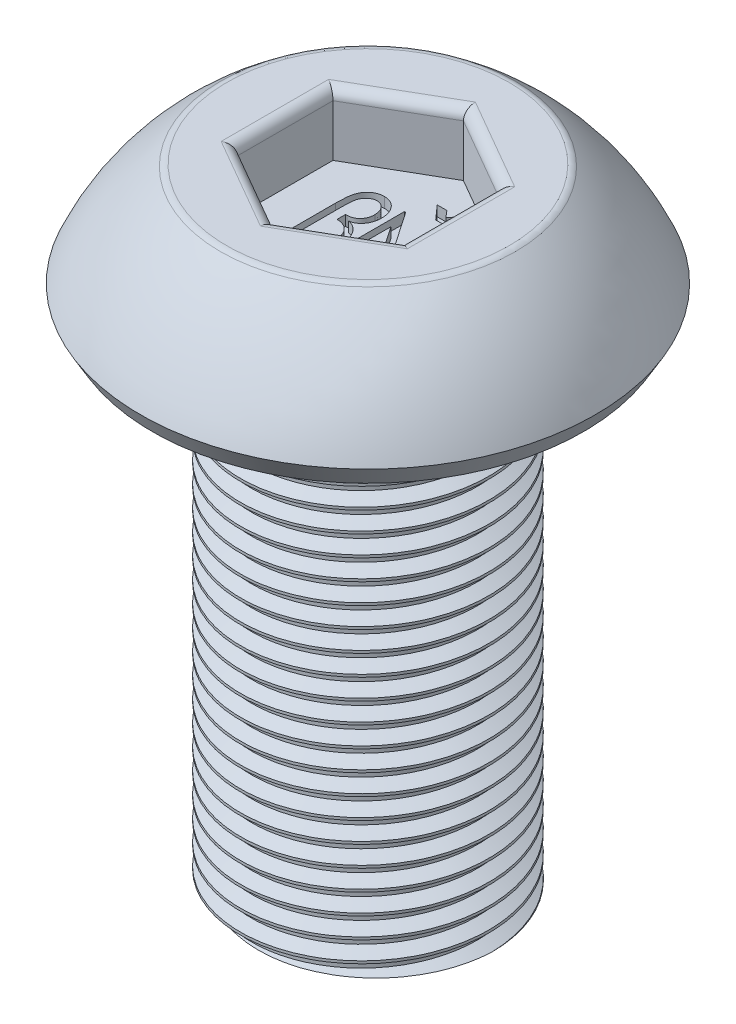
from build123d import *

# Parameters (mm, degrees)
CUT_EXTRUDE1_DEPTH = 0.75
FILLET1_R          = 0.125
WRAP1_START        = -0.125
WRAP1_DEPTH        = 0.125
THREAD1_PITCH      = 0.25


# Read off the part's stored shape, not the designer's step: Wrap1
with BuildPart() as part:
    # Sketch1 → Revolve1 (revolve)
    with BuildSketch(Plane(origin=(0, 0, 0), x_dir=(0, 0, -1), z_dir=(1, 0, 0)), mode=Mode.PRIVATE) as revolve1_sk:
        with BuildLine():
            Line((0, 1.5), (-1.75, 1.5))
            ThreePointArc((-1.75, 1.5), (-2.334912942, 0.942930354), (-2.75, 0.25))
            Line((-2.75, 0.25), (-2.605662433, 0))
            Line((-2.605662433, 0), (-1.5, 0))
            Line((-1.5, 0), (-1.5, -6))
            Line((-1.5, -6), (0, -6))
            Line((0, -6), (0, 1.5))
        make_face()
    revolve(revolve1_sk.sketch.rotate(Axis((0, -6, 0), (0, 1, 0)), 180), axis=Axis((0, -6, 0), (0, 1, 0)))

    # Sketch2 → Cut-Extrude1 (cut)
    with BuildSketch(Plane(origin=(0, 1.5, 0), x_dir=(1, 0, 0), z_dir=(0, 1, 0))):
        Polygon((0, 1.154700538), (-1, 0.577350269), (-1, -0.577350269), (0, -1.154700538), (1, -0.577350269), (1, 0.577350269), align=None)
    extrude(amount=-CUT_EXTRUDE1_DEPTH, mode=Mode.SUBTRACT)

    # Fillet1
    fillet1_edges = [part.edges().sort_by_distance(p)[0] for p in [
        (0.5, 1.5, -0.866025404),
        (-0.5, 1.5, -0.866025404),
        (-1, 1.5, 0),
        (-0.5, 1.5, 0.866025404),
        (0.5, 1.5, 0.866025404),
        (1, 1.5, 0),
        (0, 1.5, 1.75),
    ]]
    fillet(fillet1_edges, radius=FILLET1_R)

    # Wrap1 outline → Wrap1 (cut)
    with BuildSketch(Plane(origin=(0, 0.75, 0), x_dir=(1, 0, 0), z_dir=(0, 1, 0)).offset(WRAP1_START)):
        with BuildLine():
            add(Edge.make_bspline(
                [(-0.537455829, 0.145072229), (-0.537366548, 0.15735919), (-0.537194747, 0.181002472), (-0.536236546, 0.215136123), (-0.534510696, 0.246473554), (-0.531857696, 0.275057496), (-0.528751002, 0.300937263), (-0.524861231, 0.324098842), (-0.520025531, 0.344486675), (-0.512963856, 0.367808475), (-0.501673714, 0.39403328), (-0.484042302, 0.422215735), (-0.462961845, 0.447719467), (-0.43819726, 0.469796385), (-0.410438674, 0.48826361), (-0.379753396, 0.501330341), (-0.346770262, 0.509472114), (-0.323962243, 0.510388658), (-0.312295573, 0.510857485)],
                knots=[0, 0, 0, 0, 0.075666503, 0.145601872, 0.210267314, 0.268902852, 0.322354979, 0.370758742, 0.413447068, 0.451298193, 0.520734923, 0.588514213, 0.655379256, 0.723813985, 0.792131248, 0.85973193, 0.928250616, 1, 1, 1, 1], degree=3))
            Line((-0.537455829, 0.145072229), (-0.537455829, -0.527604053))
            Line((-0.537455829, -0.527604053), (-0.460532752, -0.527604053))
            Line((-0.460532752, -0.527604053), (-0.460532752, 0.137460049))
            add(Edge.make_bspline(
                [(-0.447712239, 0.305328639), (-0.448774545, 0.301469619), (-0.451134212, 0.292897693), (-0.453525545, 0.278533298), (-0.455753975, 0.261566558), (-0.457491806, 0.241915402), (-0.458861613, 0.219538201), (-0.459832928, 0.194491685), (-0.460431178, 0.166843342), (-0.460497896, 0.147543183), (-0.460532752, 0.137460049)],
                knots=[0, 0, 0, 0, 0.071102967, 0.157938928, 0.258486703, 0.375288845, 0.508476997, 0.656953648, 0.820779591, 1, 1, 1, 1], degree=3))
            add(Edge.make_bspline(
                [(-0.310292367, 0.421113895), (-0.317674297, 0.420714803), (-0.332400851, 0.419918636), (-0.353965955, 0.413875353), (-0.374511474, 0.403804365), (-0.393760239, 0.390026559), (-0.411220155, 0.372905819), (-0.426330799, 0.352966004), (-0.438683838, 0.330213781), (-0.444651659, 0.313764569), (-0.447712239, 0.305328639)],
                knots=[0, 0, 0, 0, 0.115143072, 0.229704239, 0.346728965, 0.47082069, 0.597615275, 0.727089869, 0.860038825, 1, 1, 1, 1], degree=3))
            add(Edge.make_bspline(
                [(-0.17848147, 0.261057806), (-0.178952566, 0.271974178), (-0.179864172, 0.293098195), (-0.186637459, 0.323530756), (-0.198777604, 0.350930356), (-0.212261145, 0.371485038), (-0.225066026, 0.38586534), (-0.235235588, 0.395399384), (-0.246252738, 0.403200746), (-0.257654824, 0.410013084), (-0.269995595, 0.414921405), (-0.282862679, 0.418632696), (-0.296413152, 0.420560449), (-0.305613195, 0.420927309), (-0.310292367, 0.421113895)],
                knots=[0, 0, 0, 0, 0.141583044, 0.273974039, 0.401600231, 0.528456794, 0.591043942, 0.651122908, 0.708825408, 0.765880537, 0.822988251, 0.880580103, 0.939262648, 1, 1, 1, 1], degree=3))
            add(Edge.make_bspline(
                [(-0.340941406, 0.087780562), (-0.334988303, 0.08792105), (-0.323299062, 0.088196907), (-0.306225523, 0.090764835), (-0.289888322, 0.094368098), (-0.274654087, 0.100137271), (-0.260174408, 0.107124777), (-0.24682212, 0.11601785), (-0.234254323, 0.126336142), (-0.222711003, 0.138095802), (-0.212416341, 0.151054166), (-0.203323514, 0.164708223), (-0.195692258, 0.179095557), (-0.189162431, 0.194099224), (-0.184457799, 0.209936522), (-0.181072867, 0.226359939), (-0.178698712, 0.243427453), (-0.178554801, 0.255106579), (-0.17848147, 0.261057806)],
                knots=[0, 0, 0, 0, 0.067065692, 0.131687113, 0.194317921, 0.255289037, 0.314878218, 0.375218702, 0.435653028, 0.497934511, 0.56059698, 0.621980302, 0.682601877, 0.743985199, 0.806139168, 0.868443394, 0.932963888, 1, 1, 1, 1], degree=3))
            Line((-0.340941406, 0.087780562), (-0.357968649, 0.087780562))
            Line((-0.357968649, 0.087780562), (-0.357968649, -0.014783541))
            add(Edge.make_bspline(
                [(-0.152840444, -0.246153733), (-0.152991921, -0.237935238), (-0.153288163, -0.221862292), (-0.155672785, -0.198335348), (-0.159894598, -0.176034257), (-0.165736265, -0.154867378), (-0.173053307, -0.13483662), (-0.182215246, -0.116043494), (-0.192787882, -0.098300128), (-0.20519576, -0.081953022), (-0.21910276, -0.067000398), (-0.234429011, -0.053697294), (-0.25160782, -0.04265632), (-0.269991613, -0.033131715), (-0.29004854, -0.025867397), (-0.311286964, -0.019869429), (-0.334167811, -0.016416131), (-0.349879854, -0.015338382), (-0.357968649, -0.014783541)],
                knots=[0, 0, 0, 0, 0.070899124, 0.138657723, 0.203740428, 0.266496883, 0.327925022, 0.387445969, 0.44662859, 0.505853257, 0.564143059, 0.622569358, 0.680413321, 0.739931479, 0.800819634, 0.864131594, 0.930052902, 1, 1, 1, 1], degree=3))
            add(Edge.make_bspline(
                [(-0.309891726, -0.450680977), (-0.304334961, -0.450571211), (-0.293413044, -0.450355466), (-0.277514036, -0.447340483), (-0.262286727, -0.442989313), (-0.247781817, -0.436676481), (-0.233907442, -0.428733085), (-0.221051475, -0.418678171), (-0.208664071, -0.407189838), (-0.197187775, -0.393882067), (-0.186871623, -0.37903336), (-0.17755536, -0.363253667), (-0.169907305, -0.346235338), (-0.163848892, -0.328206631), (-0.158625475, -0.30926113), (-0.155449196, -0.289102842), (-0.15305503, -0.26797937), (-0.152912733, -0.253506267), (-0.152840444, -0.246153733)],
                knots=[0, 0, 0, 0, 0.057830355, 0.113666545, 0.168061557, 0.222616608, 0.278122197, 0.334218011, 0.392319921, 0.453992458, 0.516935927, 0.58055674, 0.644719566, 0.710965936, 0.778658745, 0.849251577, 0.923417744, 1, 1, 1, 1], degree=3))
            add(Edge.make_bspline(
                [(-0.409250701, -0.417427771), (-0.40035509, -0.422552084), (-0.383473121, -0.432276934), (-0.357561529, -0.44229785), (-0.333383308, -0.449497533), (-0.317482442, -0.450298576), (-0.309891726, -0.450680977)],
                knots=[0, 0, 0, 0, 0.290177362, 0.550694617, 0.785511707, 1, 1, 1, 1], degree=3))
            Line((-0.409250701, -0.417427771), (-0.409250701, -0.507371682))
            add(Edge.make_bspline(
                [(-0.298273137, -0.540424566), (-0.308861639, -0.540097242), (-0.329301798, -0.539465371), (-0.358664913, -0.532954409), (-0.385682425, -0.522833546), (-0.401463988, -0.512480121), (-0.409250701, -0.507371682)],
                knots=[0, 0, 0, 0, 0.269471748, 0.52019112, 0.763259579, 1, 1, 1, 1], degree=3))
            add(Edge.make_bspline(
                [(-0.075917367, -0.249759502), (-0.076128163, -0.26018073), (-0.076541077, -0.280594276), (-0.079227651, -0.310491914), (-0.084396107, -0.33890103), (-0.091033777, -0.365960134), (-0.09992887, -0.391457717), (-0.110563094, -0.41559927), (-0.123397597, -0.438155636), (-0.137962217, -0.459132621), (-0.153934421, -0.478163377), (-0.171095941, -0.494958486), (-0.189740067, -0.508821331), (-0.209271063, -0.520337979), (-0.2298646, -0.529505832), (-0.251686582, -0.535889962), (-0.274626983, -0.539804561), (-0.290311376, -0.540215808), (-0.298273137, -0.540424566)],
                knots=[0, 0, 0, 0, 0.076485505, 0.149823073, 0.219996399, 0.288217649, 0.354082023, 0.417919027, 0.481558234, 0.544225908, 0.605087621, 0.663657146, 0.720011753, 0.77514507, 0.829777395, 0.884976008, 0.941611157, 1, 1, 1, 1], degree=3))
            add(Edge.make_bspline(
                [(-0.194707432, 0.00885428), (-0.185532098, 0.002246917), (-0.167142487, -0.010995852), (-0.14356067, -0.035865532), (-0.123015599, -0.064046821), (-0.106173919, -0.095826321), (-0.092429948, -0.130510752), (-0.082995533, -0.168026939), (-0.077008082, -0.208034101), (-0.076287996, -0.23558107), (-0.075917367, -0.249759502)],
                knots=[0, 0, 0, 0, 0.114174048, 0.228832702, 0.344903554, 0.466103946, 0.591676048, 0.72144281, 0.856626542, 1, 1, 1, 1], degree=3))
            add(Edge.make_bspline(
                [(-0.273032752, 0.036899152), (-0.264977593, 0.035253476), (-0.249714467, 0.032135208), (-0.228666305, 0.025295577), (-0.210172583, 0.018341569), (-0.199638474, 0.011879289), (-0.194707432, 0.00885428)],
                knots=[0, 0, 0, 0, 0.294434237, 0.557901696, 0.79305271, 1, 1, 1, 1], degree=3))
            add(Edge.make_bspline(
                [(-0.200917367, 0.061939216), (-0.205600715, 0.059219735), (-0.215469689, 0.053489114), (-0.232413767, 0.046806913), (-0.251771921, 0.040993346), (-0.265723651, 0.038306664), (-0.273032752, 0.036899152)],
                knots=[0, 0, 0, 0, 0.211315364, 0.445293882, 0.709397831, 1, 1, 1, 1], degree=3))
            add(Edge.make_bspline(
                [(-0.101558393, 0.265064216), (-0.101829728, 0.254158186), (-0.102360461, 0.23282596), (-0.107582885, 0.201794643), (-0.115635878, 0.172523389), (-0.127393107, 0.145424978), (-0.141807851, 0.120566799), (-0.158666737, 0.09801557), (-0.178511599, 0.078390972), (-0.193428545, 0.067437991), (-0.200917367, 0.061939216)],
                knots=[0, 0, 0, 0, 0.138734507, 0.271365083, 0.399463796, 0.524371928, 0.64626696, 0.764603187, 0.881822663, 1, 1, 1, 1], degree=3))
            add(Edge.make_bspline(
                [(-0.312295573, 0.510857485), (-0.304601721, 0.510709635), (-0.289468193, 0.510418818), (-0.267407867, 0.506806308), (-0.246411552, 0.501505665), (-0.226632783, 0.49383833), (-0.208041676, 0.483900131), (-0.190537128, 0.47184286), (-0.174217748, 0.457507541), (-0.159329374, 0.44106616), (-0.145724285, 0.423136003), (-0.133914037, 0.403846519), (-0.123827558, 0.383480477), (-0.115525112, 0.361982783), (-0.109489008, 0.339238969), (-0.104721569, 0.315513437), (-0.102229905, 0.290624502), (-0.101784813, 0.273682609), (-0.101558393, 0.265064216)],
                knots=[0, 0, 0, 0, 0.063537388, 0.124975739, 0.184284437, 0.242302503, 0.299838056, 0.35817297, 0.417627897, 0.478966986, 0.541230446, 0.60342781, 0.66563497, 0.728883988, 0.793562004, 0.859921094, 0.928741429, 1, 1, 1, 1], degree=3))
        make_face()
        Polygon((0.565629107, -0.527604053), (0.583056992, -0.527604053), (0.583056992, 0.472395947), (0.506133915, 0.472395947), (0.506133915, -0.290224246), (-0.016101662, 0.472395947), (-0.032327624, 0.472395947), (-0.032327624, -0.527604053), (0.044595453, -0.527604053), (0.044595453, 0.233012934), align=None)
        Polygon((0.095877504, 0.741626716), (0.244315004, 0.574960049), (0.318633915, 0.574960049), (0.467672376, 0.741626716), (0.350885517, 0.741626716), (0.280172376, 0.662700434), (0.212664363, 0.741626716), align=None)
    extrude(amount=WRAP1_DEPTH, mode=Mode.SUBTRACT)

    # Thread1: the profile of Thread Profile1 profile screwed along a right-hand helix of 27 turns, 6 arcs to a turn; built about Z, then put on its axis
    thread1_z = Axis((0, 0, 0), (0, 0, 1))
    thread1_corners = [(1.5003, 0, -0.000173205), (1.5003, 0, 0.218923204), (1.364683531, 0, 0.140625), (1.364683531, 0, 0.078125)]
    with BuildLine(mode=Mode.PRIVATE) as thread1_profile:
        Line(thread1_corners[0], thread1_corners[1])
        Line(thread1_corners[1], thread1_corners[2])
        Line(thread1_corners[2], thread1_corners[3])
        Line(thread1_corners[3], thread1_corners[0])
    thread1_cap = Face(thread1_profile.wire())
    thread1_turn_angles = [0, 30, 60, 90, 120, 150, 180, 210, 240, 270, 300, 330, 360]
    thread1_turn_weights = [1, 0.8660254037844387, 1, 0.8660254037844387, 1, 0.8660254037844387, 1, 0.8660254037844387, 1, 0.8660254037844387, 1, 0.8660254037844387, 1]
    thread1_turn_rails = [Edge.make_bspline([Vector(p[0], p[1], 0).rotate(thread1_z, thread1_turn_angles[k]) / thread1_turn_weights[k] + Vector(0, 0, p[2] + THREAD1_PITCH * thread1_turn_angles[k] / 360) for k in range(13)], [0, 0, 0, 1, 1, 2, 2, 3, 3, 4, 4, 5, 5, 6, 6, 6], 2, thread1_turn_weights) for p in thread1_corners]
    thread1_turn_sides = [Face.make_surface_from_curves(thread1_turn_rails[p[0]], thread1_turn_rails[p[1]]) for p in [(0, 1), (1, 2), (2, 3), (3, 0)]]
    thread1 = Plane(origin=(0, -7, 0), x_dir=(1, 0, 0), z_dir=(0, 1, 0)) * Solid(Shell([*[p.moved(Location((0, 0, THREAD1_PITCH * i))) for i in range(27) for p in thread1_turn_sides], thread1_cap, thread1_cap.rotate(thread1_z, 9720).moved(Location((0, 0, THREAD1_PITCH * 9720 / 360)))]))
    add(thread1, mode=Mode.SUBTRACT)


solid = part.part
